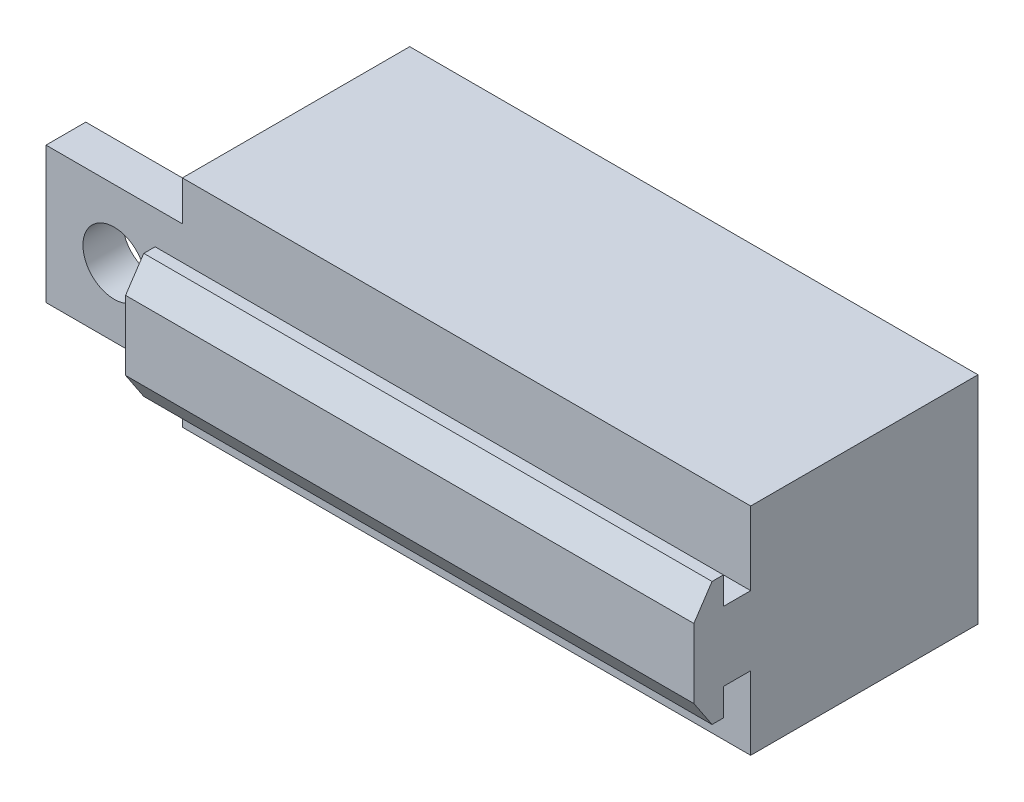
from build123d import *

# Parameters (mm, degrees)
SKETCH1_W               = 50
SKETCH1_H               = 25
BOSS_EXTRUDE1_DEPTH     = 19
CUT_EXTRUDE1_DEPTH      = 55.929500271
CUT_EXTRUDE1_DEPTH_BACK = 55.929500271
SKETCH3_W               = 3.5
SKETCH3_H               = 12
BOSS_EXTRUDE2_DEPTH     = 12
CUT_EXTRUDE2_REACH      = 46.747
SKETCH4_R               = 2.75


with BuildPart() as part:
    # Sketch1 → Boss-Extrude1 (new body)
    with BuildSketch(Plane(origin=(0, 0, 0), x_dir=(1, 0, 0), z_dir=(0, 1, 0))):
        Rectangle(SKETCH1_W, SKETCH1_H)
    extrude(amount=BOSS_EXTRUDE1_DEPTH)

    # Sketch2 → Cut-Extrude1 (cut, two sides: drawn at the far end of the back side and taken through both)
    with BuildSketch(Plane(origin=(25, 0, 0), x_dir=(0, 0, -1), z_dir=(1, 0, 0)).offset(-CUT_EXTRUDE1_DEPTH_BACK)):
        Polygon((-7.5, 84.172456897), (-7.5, 19), (-7.5, 12.55), (-9.9, 12.55), (-9.9, 14.95), (-10.9, 14.95), (-12.5, 12.55), (-12.5, 6.45), (-10.9, 4.05), (-9.9, 4.05), (-9.9, 6.45), (-7.5, 6.45), (-7.5, 0), (-7.5, -65.172456897), (-137.844913793, -65.172456897), (-137.844913793, 84.172456897), align=None)
    extrude(amount=CUT_EXTRUDE1_DEPTH + CUT_EXTRUDE1_DEPTH_BACK, mode=Mode.SUBTRACT)

    # Sketch3 → Boss-Extrude2 (add)
    with BuildSketch(Plane.ZY.offset(25)):
        with Locations((5.75, 9.5)):
            Rectangle(SKETCH3_W, SKETCH3_H)
    extrude(amount=BOSS_EXTRUDE2_DEPTH)

    # Sketch4 → Cut-Extrude2 (cut, up to next)
    with BuildSketch(Plane(origin=(0, 0, 4), x_dir=(-1, 0, 0), z_dir=(0, 0, -1)), mode=Mode.PRIVATE) as cut_extrude2_sk1:
        with Locations((31, 9.5)):
            Circle(SKETCH4_R)
    cut_extrude2_tool1 = extrude(cut_extrude2_sk1.sketch, amount=-CUT_EXTRUDE2_REACH, mode=Mode.PRIVATE) & part.part
    add(cut_extrude2_tool1.solids().sort_by_distance((-31, 9.5, 4))[0], mode=Mode.SUBTRACT)


solid = part.part
